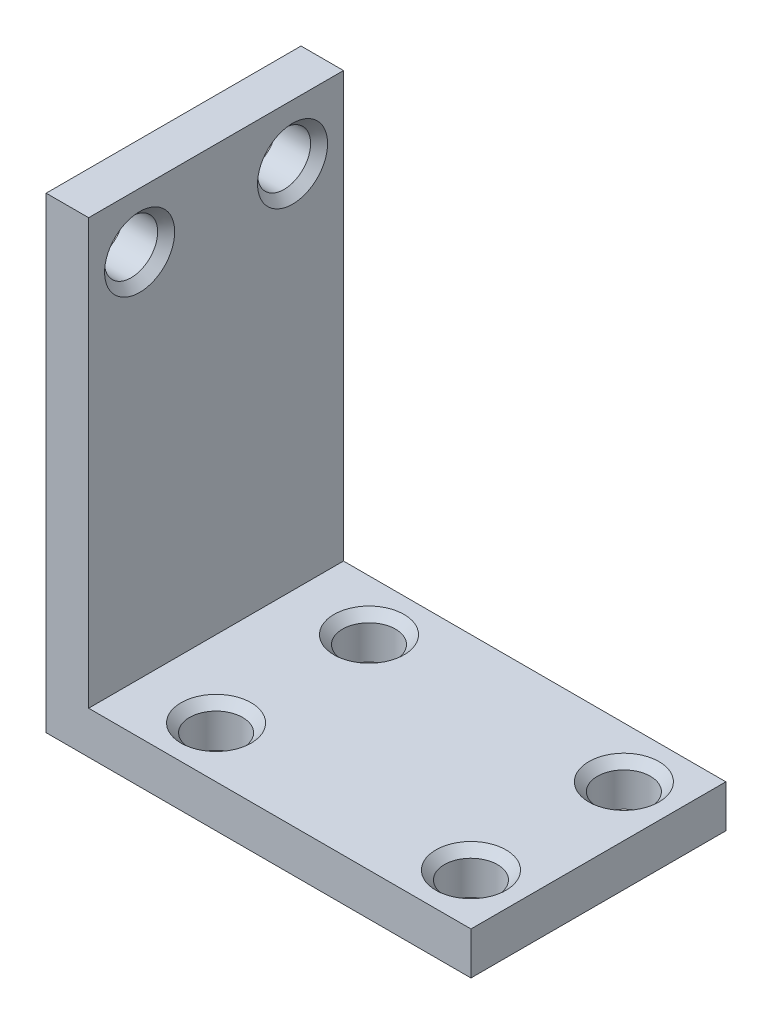
from build123d import *

# Parameters (mm, degrees)
SKETCH_1_W                     = 10
SKETCH_1_H                     = 6
EXTRUDE_1_DEPTH                = 1
SKETCH_2_W                     = 1
SKETCH_2_H                     = 6
EXTRUDE_2_DEPTH                = 10
HOLE_WIZARD_M1_6_2_D           = 1.25
HOLE_WIZARD_M1_6_2_CSINK_D     = 1.65
HOLE_WIZARD_M1_6_2_CSINK_ANGLE = 90
HOLE_WIZARD_M1_6_4_D           = 1.25
HOLE_WIZARD_M1_6_4_CSINK_D     = 1.65
HOLE_WIZARD_M1_6_4_CSINK_ANGLE = 90


# Read off the part's stored shape, not the designer's step: M1.6 螺纹孔3
with BuildPart() as part:
    # 草图1 → 凸台-拉伸1 (new body)
    with BuildSketch(Plane(origin=(0, 0, 0), x_dir=(1, 0, 0), z_dir=(0, 1, 0))):
        Rectangle(SKETCH_1_W, SKETCH_1_H)
    extrude(amount=EXTRUDE_1_DEPTH)

    # 草图2 → 凸台-拉伸2 (add)
    with BuildSketch(Plane(origin=(0, 1, 0), x_dir=(1, 0, 0), z_dir=(0, 1, 0))):
        with Locations((-4.5, 0)):
            Rectangle(SKETCH_2_W, SKETCH_2_H)
    extrude(amount=EXTRUDE_2_DEPTH)

    # M1.6 螺纹孔2 (through all)
    with Locations(Plane(origin=(-4, 0, 0), x_dir=(0, 0, -1), z_dir=(1, 0, 0))):
        with Locations((-1.8, 9.7), (1.8, 9.7)):
            CounterSinkHole(HOLE_WIZARD_M1_6_2_D / 2, HOLE_WIZARD_M1_6_2_CSINK_D / 2, counter_sink_angle=HOLE_WIZARD_M1_6_2_CSINK_ANGLE)

    # M1.6 螺纹孔3 outline → M1.6 螺纹孔3 (revolve, cut)
    with BuildSketch(Plane(origin=(3.8, 0, 1.8), x_dir=(1, 0, 0), z_dir=(0, 0, 1))):
        Polygon((0, 0), (0.625, 0), (0.625, 0.8), (0.825, 1), (0, 1), align=None)
    revolve(axis=Axis((3.8, 0, 1.8), (0, 1, 0)), mode=Mode.SUBTRACT)

    # Hole Wizard M1.6 _3 2 outline → Hole Wizard M1.6 _3 2 (revolve, cut)
    with BuildSketch(Plane(origin=(3.8, 0, -1.8), x_dir=(1, 0, 0), z_dir=(0, 0, 1))):
        Polygon((0, 0), (0.625, 0), (0.625, 0.8), (0.825, 1), (0, 1), align=None)
    revolve(axis=Axis((3.8, 0, -1.8), (0, 1, 0)), mode=Mode.SUBTRACT)

    # M1.6 螺纹孔4 (through all)
    with Locations(Plane(origin=(0, 1, 0), x_dir=(1, 0, 0), z_dir=(0, 1, 0))):
        with Locations((-2.2, -1.8), (-2.2, 1.8)):
            CounterSinkHole(HOLE_WIZARD_M1_6_4_D / 2, HOLE_WIZARD_M1_6_4_CSINK_D / 2, counter_sink_angle=HOLE_WIZARD_M1_6_4_CSINK_ANGLE)


solid = part.part
